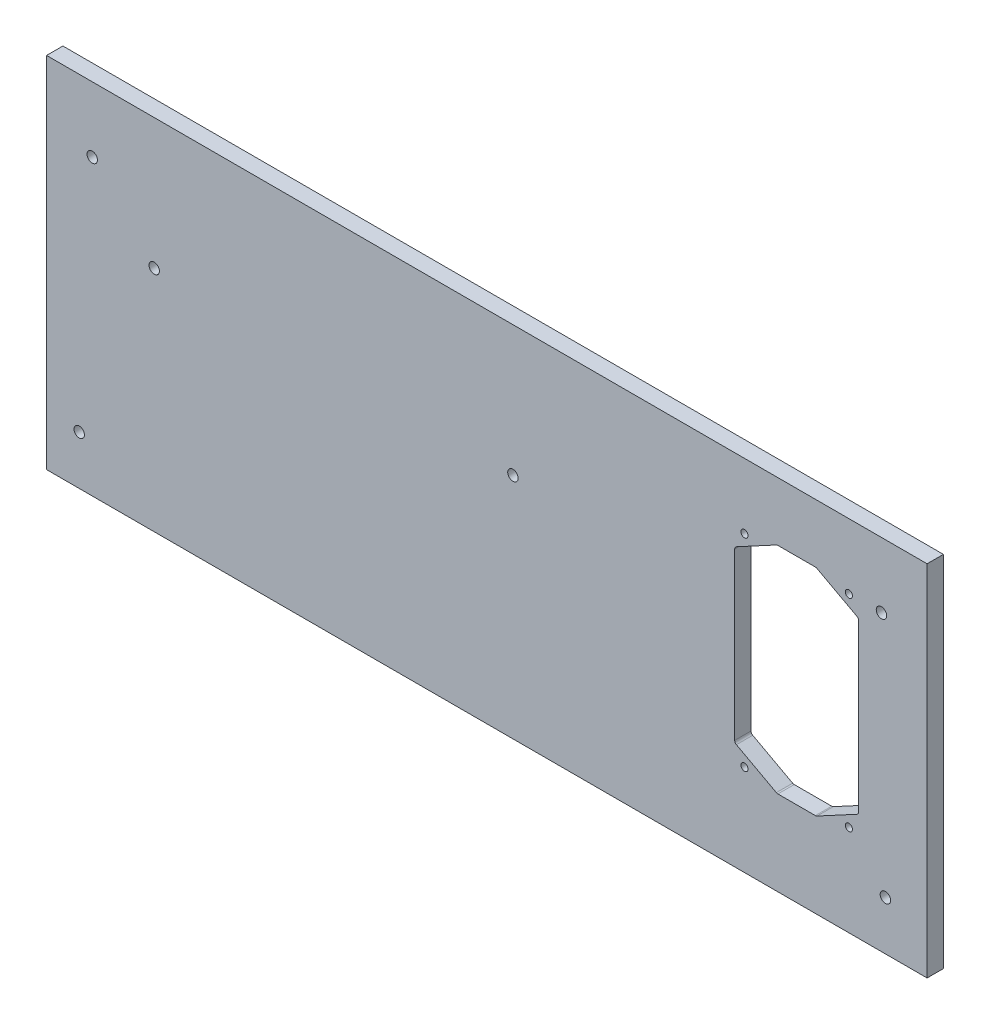
from build123d import *

# Parameters (mm, degrees)
SKETCH1_W                             = 270
SKETCH1_H                             = 110
SHEET_DEPTH                           = 2.5
SKETCH4_R                             = 1.1
CUT_EXTRUDE1_DEPTH                    = 146.859521458
FILLET1_R                             = 1
F_3_2_3_2_MOUNTHOLES_D                = 3.2
F_3_2_3_2_MOUNTHOLES_CSINK_D          = 6.5
F_3_2_3_2_MOUNTHOLES_CSINK_ANGLE      = 90
F_3_2_3_2_MIDDLEPARTHOLES_D           = 3.2
F_3_2_3_2_MIDDLEPARTHOLES_CSINK_D     = 6.5
F_3_2_3_2_MIDDLEPARTHOLES_CSINK_ANGLE = 90


with BuildPart() as part:
    # Sketch1 → Sheet (new, symmetric)
    with BuildSketch(Plane.XY):
        Rectangle(SKETCH1_W, SKETCH1_H)
    extrude(amount=SHEET_DEPTH, both=True)

    # Sketch4 → Cut-Extrude1 (cut, through all)
    with BuildSketch(Plane(origin=(0, 0, -2.5), x_dir=(-1, 0, 0), z_dir=(0, 0, -1))):
        with Locations((-79, 35)):
            Circle(SKETCH4_R)
        with Locations((-111, 35)):
            Circle(SKETCH4_R)
        with Locations((-111, -27)):
            Circle(SKETCH4_R)
        with Locations((-79, -27)):
            Circle(SKETCH4_R)
        Polygon((-101, 37), (-114, 30), (-114, -22), (-101, -29), (-89, -29), (-76, -22), (-76, 30), (-89, 37), align=None)
    extrude(amount=-CUT_EXTRUDE1_DEPTH, mode=Mode.SUBTRACT)

    # Fillet1
    fillet1_edges = [part.edges().sort_by_distance(p)[0] for p in [
        (76, 30, 0),
        (89, -29, 0),
        (101, -29, 0),
        (114, -22, 0),
        (114, 30, 0),
        (101, 37, 0),
        (89, 37, 0),
        (76, -22, 0),
    ]]
    fillet(fillet1_edges, radius=FILLET1_R)

    # Ø3.2 (3.2) MountHoles (through all)
    with Locations(Plane(origin=(0, 0, -2.5), x_dir=(-1, 0, 0), z_dir=(0, 0, -1))):
        with Locations((-121, 35), (-122.21675296, -40), (125, -40), (121, 35)):
            CounterSinkHole(F_3_2_3_2_MOUNTHOLES_D / 2, F_3_2_3_2_MOUNTHOLES_CSINK_D / 2, counter_sink_angle=F_3_2_3_2_MOUNTHOLES_CSINK_ANGLE)

    # Ø3.2 (3.2) MiddlePartHoles (through all)
    with Locations(Plane(origin=(0, 0, -2.5), x_dir=(-1, 0, 0), z_dir=(0, 0, -1))):
        with Locations((-8, 15), (102, 15)):
            CounterSinkHole(F_3_2_3_2_MIDDLEPARTHOLES_D / 2, F_3_2_3_2_MIDDLEPARTHOLES_CSINK_D / 2, counter_sink_angle=F_3_2_3_2_MIDDLEPARTHOLES_CSINK_ANGLE)


solid = part.part
